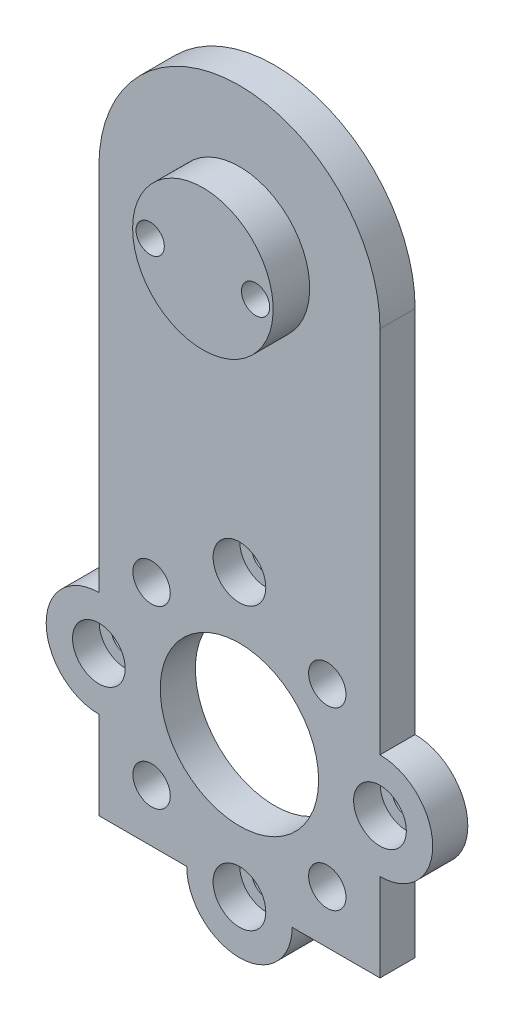
from build123d import *

# Parameters (mm, degrees)
SKETCH1_R                                       = 3.3782
SKETCH1_R_2                                     = 14.3129
BOSS_EXTRUDE1_DEPTH                             = 6.35
SKETCH2_R                                       = 12.7
BOSS_EXTRUDE2_DEPTH                             = 6.604
CBORE_FOR_10_SOCKET_HEAD_CAP_SCREW1_D           = 5.1054
CBORE_FOR_10_SOCKET_HEAD_CAP_SCREW1_CBORE_D     = 9.525
CBORE_FOR_10_SOCKET_HEAD_CAP_SCREW1_CBORE_DEPTH = 4.826
F_1_4_20_TAPPED_HOLE2_D                         = 5.1054


with BuildPart() as part:
    # Sketch1 → Boss-Extrude1 (new body)
    with BuildSketch(Plane.XY):
        with BuildLine():
            Line((0, 0), (15.875, 0))
            ThreePointArc((15.875, 0), (25.4, -9.525), (34.925, 0))
            Line((34.925, 0), (50.8, 0))
            Line((50.8, 0), (50.8, 15.875))
            ThreePointArc((50.8, 15.875), (60.325, 25.4), (50.8, 34.925))
            Line((50.8, 34.925), (50.8, 101.6))
            ThreePointArc((50.8, 101.6), (25.4, 127), (0, 101.6))
            Line((0, 101.6), (0, 34.925))
            ThreePointArc((0, 34.925), (-9.525, 25.4), (0, 15.875))
            Line((0, 15.875), (0, 0))
        make_face()
        with Locations((41.275, 9.525)):
            Circle(SKETCH1_R, mode=Mode.SUBTRACT)
        with Locations((9.525, 9.525)):
            Circle(SKETCH1_R, mode=Mode.SUBTRACT)
        with Locations((9.525, 41.275)):
            Circle(SKETCH1_R, mode=Mode.SUBTRACT)
        with Locations((41.275, 41.275)):
            Circle(SKETCH1_R, mode=Mode.SUBTRACT)
        with Locations((25.4, 25.4)):
            Circle(SKETCH1_R_2, mode=Mode.SUBTRACT)
    extrude(amount=BOSS_EXTRUDE1_DEPTH)

    # Sketch2 → Boss-Extrude2 (add)
    with BuildSketch(Plane.XY.offset(6.35)):
        with Locations((25.4, 101.6)):
            Circle(SKETCH2_R)
    extrude(amount=BOSS_EXTRUDE2_DEPTH)

    # CBORE for #10 Socket Head Cap Screw1 (through all)
    with Locations(Plane.XY.offset(6.35)):
        with Locations((0, 25.4), (50.8, 25.4), (25.4, 0), (25.4, 50.8)):
            CounterBoreHole(CBORE_FOR_10_SOCKET_HEAD_CAP_SCREW1_D / 2, CBORE_FOR_10_SOCKET_HEAD_CAP_SCREW1_CBORE_D / 2, CBORE_FOR_10_SOCKET_HEAD_CAP_SCREW1_CBORE_DEPTH)

    # 1/4-20 Tapped Hole2 (through all)
    with Locations(Plane.XY.offset(12.954)):
        with Locations((15.875, 101.6), (34.925, 101.6)):
            Hole(F_1_4_20_TAPPED_HOLE2_D / 2)


solid = part.part
